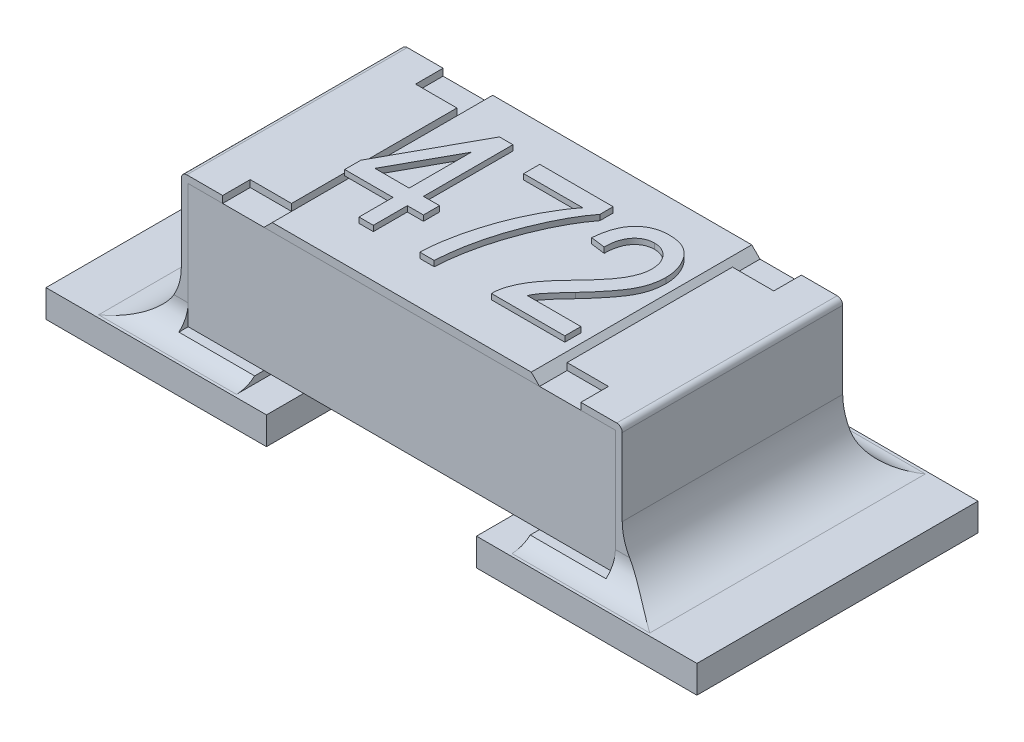
from build123d import *

# Parameters (mm, degrees)
SKETCH1_W             = 0.8
SKETCH1_H             = 0.45
BOSS_EXTRUDE1_DEPTH   = 0.775
BOSS_EXTRUDE2_DEPTH   = 0.4
BOSS_EXTRUDE2_2_DEPTH = 0.4
SKETCH3_W             = 0.15
SKETCH3_H             = 0.1
CUT_EXTRUDE1_DEPTH    = 0.025
BOSS_EXTRUDE3_DEPTH   = 0.4
SKETCH7_W             = 0.8
SKETCH7_H             = 1.02
BOSS_EXTRUDE5_DEPTH   = 0.1
FILLET3_R             = 0.2
FILLET4_R             = 0.2
FILLET5_R             = 0.1
FILLET6_R             = 0.1
BOSS_EXTRU_1_DEPTH    = 0.02


with BuildPart() as part:
    # Sketch1 → Boss-Extrude1 (new, symmetric)
    with BuildSketch(Plane(origin=(0, 0, 0), x_dir=(0, 0, -1), z_dir=(1, 0, 0))):
        with Locations((0, 0.35)):
            Rectangle(SKETCH1_W, SKETCH1_H)
    extrude(amount=BOSS_EXTRUDE1_DEPTH, both=True)


with BuildPart() as body_2:
    # Sketch2 → Boss-Extrude2 (new, symmetric)
    with BuildSketch(Plane.XY):
        with BuildLine():
            Line((-0.5, 0.6), (-0.78, 0.6))
            ThreePointArc((-0.78, 0.6), (-0.794142136, 0.594142136), (-0.8, 0.58))
            Line((-0.8, 0.58), (-0.8, 0.1))
            Line((-0.8, 0.1), (-0.5, 0.1))
            Line((-0.5, 0.1), (-0.5, 0.125))
            Line((-0.5, 0.125), (-0.775, 0.125))
            Line((-0.775, 0.125), (-0.775, 0.575))
            Line((-0.775, 0.575), (-0.5, 0.575))
            Line((-0.5, 0.575), (-0.5, 0.6))
        make_face()
    extrude(amount=BOSS_EXTRUDE2_DEPTH, both=True)


with BuildPart() as body_3:
    # Sketch2 → Boss-Extrude2 2 (new, symmetric)
    with BuildSketch(Plane.XY):
        with BuildLine():
            Line((0.5, 0.575), (0.5, 0.6))
            Line((0.5, 0.6), (0.78, 0.6))
            ThreePointArc((0.78, 0.6), (0.794142136, 0.594142136), (0.8, 0.58))
            Line((0.8, 0.58), (0.8, 0.1))
            Line((0.8, 0.1), (0.5, 0.1))
            Line((0.5, 0.1), (0.5, 0.125))
            Line((0.5, 0.125), (0.775, 0.125))
            Line((0.775, 0.125), (0.775, 0.575))
            Line((0.775, 0.575), (0.5, 0.575))
        make_face()
    extrude(amount=BOSS_EXTRUDE2_2_DEPTH, both=True)


with BuildPart() as cut_extrude1_tool:
    # Sketch3 → Cut-Extrude1 (new body)
    with BuildSketch(Plane(origin=(0, 0.6, 0), x_dir=(1, 0, 0), z_dir=(0, 1, 0))):
        with Locations((-0.575, 0.35)):
            Rectangle(SKETCH3_W, SKETCH3_H)
        with Locations((-0.575, -0.35)):
            Rectangle(SKETCH3_W, SKETCH3_H)
        with Locations((0.575, -0.35)):
            Rectangle(SKETCH3_W, SKETCH3_H)
        with Locations((0.575, 0.35)):
            Rectangle(SKETCH3_W, SKETCH3_H)
    extrude(amount=-CUT_EXTRUDE1_DEPTH)


with BuildPart() as body_2_1:
    add(body_2.part)

    # Cut-Extrude1: cut by cut_extrude1_tool
    add(cut_extrude1_tool.part, mode=Mode.SUBTRACT)



with BuildPart() as body_3_1:
    add(body_3.part)

    # Cut-Extrude1: cut by cut_extrude1_tool
    add(cut_extrude1_tool.part, mode=Mode.SUBTRACT)


with BuildPart() as body_4:
    # Sketch4 → Boss-Extrude3 (new, symmetric)
    with BuildSketch(Plane.XY):
        Polygon((-0.5, 0.575), (0.5, 0.575), (0.47, 0.605), (-0.47, 0.605), align=None)
    extrude(amount=BOSS_EXTRUDE3_DEPTH, both=True)

    # Esquisse2 → Boss.-Extru.1 (add)
    # profile 1 of 3: a face of its own
    with BuildSketch(Plane(origin=(0, 0.605, 0), x_dir=(1, 0, 0), z_dir=(0, 1, 0))):
        Polygon((-0.309886691, -0.245221888), (-0.309886691, -0.121845264), (-0.485211367, -0.121845264), (-0.485211367, -0.063403706), (-0.306944321, 0.261271619), (-0.257938639, 0.261271619), (-0.257938639, -0.063403706), (-0.199497081, -0.063403706), (-0.199497081, -0.121845264), (-0.257938639, -0.121845264), (-0.257938639, -0.245221888), align=None)
        Polygon((-0.309886691, -0.063403706), (-0.309886691, 0.162550028), (-0.433973542, -0.063403706), align=None, mode=Mode.SUBTRACT)
    # profile 2 of 3: a face of its own
    with BuildSketch(Plane(origin=(0, 0.605, 0), x_dir=(1, 0, 0), z_dir=(0, 1, 0))):
        with BuildLine():
            Line((-0.147549029, 0.189843048), (-0.147549029, 0.248284606))
            Line((-0.147549029, 0.248284606), (0.118684737, 0.248284606))
            Line((0.118684737, 0.248284606), (0.118684737, 0.200496457))
            add(Edge.make_bspline(
                [(0.118684737, 0.200496457), (0.11374506, 0.193883112), (0.103690577, 0.180421956), (0.089629665, 0.15888939), (0.075954824, 0.135956865), (0.062653235, 0.111604996), (0.049881166, 0.085755524), (0.037509723, 0.058489528), (0.02565439, 0.029704454), (0.014307924, -0.000233926), (0.003675417, -0.030854621), (-0.005742033, -0.061692329), (-0.013988634, -0.092449334), (-0.020962495, -0.123124227), (-0.026905964, -0.153701204), (-0.031550699, -0.184233606), (-0.035053075, -0.21472856), (-0.036458112, -0.235069144), (-0.037159418, -0.245221888)],
                knots=[0, 0, 0, 0, 0.828235292, 1.685834407, 2.579347319, 3.50739146, 4.469751317, 5.472290501, 6.511687755, 7.593421113, 8.685056077, 9.764080991, 10.828622054, 11.880069368, 12.920502423, 13.954003105, 14.978766756, 16, 16, 16, 16], degree=3))
            Line((-0.037159418, -0.245221888), (-0.08910747, -0.245221888))
            add(Edge.make_bspline(
                [(-0.08910747, -0.245221888), (-0.088946966, -0.239876054), (-0.088619538, -0.228970553), (-0.087305949, -0.2122975), (-0.085650055, -0.194926574), (-0.083168557, -0.176934464), (-0.080118357, -0.158294079), (-0.076411626, -0.13902896), (-0.072322113, -0.11904052), (-0.065773685, -0.091649168), (-0.056543919, -0.057339348), (-0.043279746, -0.016938754), (-0.028326509, 0.022538381), (-0.011308019, 0.060586243), (0.006839864, 0.096834643), (0.025951357, 0.13052881), (0.045471344, 0.161610603), (0.059774471, 0.180599823), (0.066736685, 0.189843048)],
                knots=[0, 0, 0, 0, 0.54755489, 1.117011975, 1.712111195, 2.334110413, 2.976306168, 3.645990646, 4.342828197, 5.06521062, 6.529487471, 7.979439287, 9.417531512, 10.850025522, 12.245424871, 13.566691952, 14.815558909, 16, 16, 16, 16], degree=3))
            Line((0.066736685, 0.189843048), (-0.147549029, 0.189843048))
        make_face()
    # profile 3 of 3: a face of its own
    with BuildSketch(Plane(origin=(0, 0.605, 0), x_dir=(1, 0, 0), z_dir=(0, 1, 0))):
        with BuildLine():
            Line((0.436866556, -0.186780329), (0.436866556, -0.245221888))
            Line((0.436866556, -0.245221888), (0.170632789, -0.245221888))
            add(Edge.make_bspline(
                [(0.170632789, -0.245221888), (0.170620463, -0.242176838), (0.170595488, -0.236007517), (0.171425805, -0.226601844), (0.173131761, -0.216968453), (0.175310093, -0.206978835), (0.17839873, -0.196764374), (0.182179794, -0.186275439), (0.186641118, -0.175538143), (0.191864922, -0.164488895), (0.197969199, -0.153021711), (0.205335292, -0.141184566), (0.213800759, -0.128765128), (0.223376797, -0.115839112), (0.234250689, -0.102529104), (0.246099687, -0.088637518), (0.259092893, -0.074193289), (0.268344083, -0.064593521), (0.273108439, -0.059649647)],
                knots=[0, 0, 0, 0, 0.672188691, 1.361865275, 2.08134618, 2.831455259, 3.618325166, 4.435686407, 5.292818481, 6.184803937, 7.133719261, 8.159707436, 9.261705982, 10.452168352, 11.710682541, 13.056179633, 14.483934645, 16, 16, 16, 16], degree=3))
            add(Edge.make_bspline(
                [(0.273108439, -0.059649647), (0.278645154, -0.053922862), (0.28930567, -0.042896383), (0.304309328, -0.026615111), (0.317941658, -0.011481871), (0.329930295, 0.002776991), (0.340488081, 0.015967273), (0.349721239, 0.028070116), (0.357188517, 0.039360185), (0.365251054, 0.052644574), (0.372937537, 0.068459429), (0.379732824, 0.086894144), (0.384123449, 0.104715028), (0.384658645, 0.116463957), (0.384918504, 0.122168535)],
                knots=[0, 0, 0, 0, 1.312560889, 2.527233899, 3.64818266, 4.668586789, 5.596397896, 6.432357998, 7.175835261, 7.825761013, 8.992224112, 10.065918602, 11.060925749, 12, 12, 12, 12], degree=3))
            add(Edge.make_bspline(
                [(0.384918504, 0.122168535), (0.38488227, 0.125317915), (0.384811501, 0.131468985), (0.383608892, 0.140451965), (0.381893813, 0.14899617), (0.3796294, 0.157163351), (0.376418723, 0.164819361), (0.372571791, 0.172017316), (0.368065657, 0.178789817), (0.362923472, 0.185037408), (0.357252813, 0.190673516), (0.351276734, 0.195736851), (0.344839772, 0.199834879), (0.338206488, 0.203402296), (0.33115273, 0.205987741), (0.323827032, 0.207958519), (0.316161618, 0.209069733), (0.310956748, 0.209238117), (0.308315419, 0.209323567)],
                knots=[0, 0, 0, 0, 1.164486654, 2.274364258, 3.346924328, 4.388668322, 5.404300818, 6.412115579, 7.404820287, 8.409522099, 9.400647826, 10.360464378, 11.301161788, 12.219192522, 13.141987859, 14.073903283, 15.022558797, 16, 16, 16, 16], degree=3))
            add(Edge.make_bspline(
                [(0.308315419, 0.209323567), (0.305467549, 0.209263822), (0.299908376, 0.209147197), (0.291805518, 0.207697867), (0.284041492, 0.205758951), (0.276655696, 0.202751859), (0.269702154, 0.198899959), (0.263080695, 0.194263463), (0.256920928, 0.188754733), (0.251098767, 0.182490648), (0.245994902, 0.175347606), (0.241308805, 0.167618053), (0.237618701, 0.158974566), (0.234481048, 0.149683668), (0.232023772, 0.139637057), (0.230381279, 0.128872622), (0.229176758, 0.117392989), (0.229109112, 0.109489326), (0.229074348, 0.105427463)],
                knots=[0, 0, 0, 0, 0.928788257, 1.813037313, 2.680996359, 3.53827917, 4.408273621, 5.272359245, 6.172129225, 7.102295458, 8.058839945, 9.034325244, 10.048074492, 11.120300332, 12.234644845, 13.420320921, 14.674247329, 16, 16, 16, 16], degree=3))
            Line((0.229074348, 0.105427463), (0.177126296, 0.11192097))
            add(Edge.make_bspline(
                [(0.177126296, 0.11192097), (0.177661646, 0.117949128), (0.178700249, 0.129644029), (0.181425255, 0.146574214), (0.185206691, 0.162282392), (0.189695492, 0.176925272), (0.195342921, 0.190321129), (0.201656925, 0.202713751), (0.209140532, 0.213833745), (0.217485989, 0.223818585), (0.226623406, 0.232677174), (0.236501282, 0.24032371), (0.247106206, 0.246769595), (0.258317066, 0.252189545), (0.270365598, 0.256236922), (0.283035651, 0.259174418), (0.296430274, 0.260914731), (0.305570867, 0.261150899), (0.310243179, 0.261271619)],
                knots=[0, 0, 0, 0, 1.296155121, 2.514599762, 3.669097984, 4.755193195, 5.79120272, 6.77953026, 7.729955905, 8.65570694, 9.562583864, 10.450894749, 11.325630111, 12.216772649, 13.112585423, 14.04224033, 14.999270054, 16, 16, 16, 16], degree=3))
            add(Edge.make_bspline(
                [(0.310243179, 0.261271619), (0.315287924, 0.261123536), (0.325110881, 0.260835194), (0.339410791, 0.258935248), (0.352748071, 0.255583871), (0.365182294, 0.250920378), (0.376564128, 0.244781019), (0.387078711, 0.237416689), (0.396550564, 0.228603521), (0.404979649, 0.21857538), (0.412428841, 0.207748797), (0.418928747, 0.196427916), (0.424566895, 0.18480032), (0.428973266, 0.172736626), (0.432653055, 0.16039874), (0.434964779, 0.147599635), (0.436592216, 0.134486989), (0.436774592, 0.125623379), (0.436866556, 0.121153924)],
                knots=[0, 0, 0, 0, 1.141256367, 2.222215694, 3.255808886, 4.246221905, 5.218350639, 6.173592628, 7.142736081, 8.136099926, 9.131465336, 10.11177911, 11.087094076, 12.050634184, 13.014356534, 13.995714735, 14.989343724, 16, 16, 16, 16], degree=3))
            add(Edge.make_bspline(
                [(0.436866556, 0.121153924), (0.436779909, 0.117127141), (0.436607744, 0.109126037), (0.4354878, 0.097187936), (0.43351089, 0.085410333), (0.43094396, 0.073679984), (0.427301469, 0.062178516), (0.423177974, 0.050723257), (0.418176495, 0.039443439), (0.412272125, 0.028118881), (0.405358874, 0.016348836), (0.397074513, 0.003918486), (0.387572676, -0.009504436), (0.376467413, -0.023680764), (0.364296829, -0.039018169), (0.350523248, -0.055130192), (0.335415402, -0.072158915), (0.324771484, -0.083713449), (0.319273211, -0.089682115)],
                knots=[0, 0, 0, 0, 0.78053567, 1.550902233, 2.321464013, 3.094364546, 3.87611052, 4.657966429, 5.453363508, 6.265521698, 7.132350641, 8.097801917, 9.160103787, 10.319208993, 11.587678713, 12.955014444, 14.427067756, 16, 16, 16, 16], degree=3))
            add(Edge.make_bspline(
                [(0.319273211, -0.089682115), (0.31578272, -0.093395828), (0.30911211, -0.100493032), (0.299665728, -0.110762774), (0.291188926, -0.120105032), (0.28349715, -0.128388282), (0.276970664, -0.135891091), (0.271312279, -0.142415262), (0.266688943, -0.148041211), (0.259760015, -0.156885556), (0.251020841, -0.169347157), (0.244983139, -0.181095194), (0.242061361, -0.186780329)],
                knots=[0, 0, 0, 0, 1.227496676, 2.345844757, 3.360613726, 4.265798447, 5.068085109, 5.75545707, 6.345771879, 6.821573405, 8.46188917, 10, 10, 10, 10], degree=3))
            Line((0.242061361, -0.186780329), (0.436866556, -0.186780329))
        make_face()
    extrude(amount=BOSS_EXTRU_1_DEPTH)


with BuildPart() as body_2_2:
    add(body_2_1.part)

    add(body_3_1.part)  # Boss-Extrude5 merges body 3
    # Sketch7 → Boss-Extrude5 (add)
    with BuildSketch(Plane(origin=(0, 0, 0), x_dir=(1, 0, 0), z_dir=(0, 1, 0))):
        with Locations((-0.781, 0)):
            Rectangle(SKETCH7_W, SKETCH7_H)
        with Locations((0.781, 0)):
            Rectangle(SKETCH7_W, SKETCH7_H)
    extrude(amount=BOSS_EXTRUDE5_DEPTH)

    # Fillet3
    fillet3_edges = [body_2_2.edges().sort_by_distance(p)[0] for p in [
        (-0.8, 0.1, 0),
    ]]
    fillet(fillet3_edges, radius=FILLET3_R)

    # Fillet4
    fillet4_edges = [body_2_2.edges().sort_by_distance(p)[0] for p in [
        (0.8, 0.1, 0),
    ]]
    fillet(fillet4_edges, radius=FILLET4_R)

    # Fillet5
    fillet5_edges = [body_2_2.edges().sort_by_distance(p)[0] for p in [
        (0.75, 0.1, 0.4),
    ]]
    fillet(fillet5_edges, radius=FILLET5_R)
    fillet5_2_edges = [body_2_2.edges().sort_by_distance(p)[0] for p in [
        (0.75, 0.1, -0.4),
    ]]
    fillet(fillet5_2_edges, radius=FILLET5_R)

    # Fillet6
    fillet6_edges = [body_2_2.edges().sort_by_distance(p)[0] for p in [
        (-0.75, 0.1, -0.4),
    ]]
    fillet(fillet6_edges, radius=FILLET6_R)
    fillet6_2_edges = [body_2_2.edges().sort_by_distance(p)[0] for p in [
        (-0.75, 0.1, 0.4),
    ]]
    fillet(fillet6_2_edges, radius=FILLET6_R)


solid = Compound([part.part, body_4.part, body_2_2.part])
